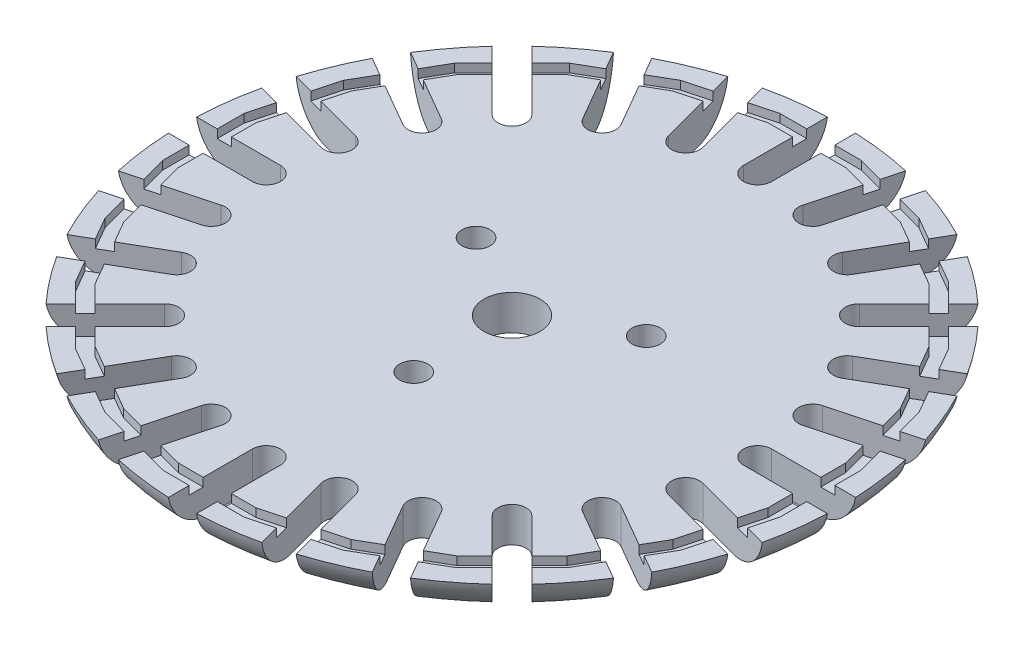
from build123d import *

# Parameters (mm, degrees)
ESBO_O1_R                = 23.5
RESSALTO_EXTRUS_O1_DEPTH = 2.5
FILETE1_R                = 3
CORTE_EXTRUS_O1_DEPTH    = 34.327916234
PADR_OCIRCULAR1_COUNT    = 24
CORTE_EXTRUS_O2_DEPTH    = 0.6
PADR_OCIRCULAR2_COUNT    = 24
ESBO_O5_R                = 2
CORTE_EXTRUS_O3_DEPTH    = 34.29789798
ESBO_O6_R                = 1
CORTE_EXTRUS_O4_DEPTH    = 34.29789798
ESBO_O7_R                = 2
CORTE_EXTRUS_O5_DEPTH    = 1
PADR_OCIRCULAR3_COUNT    = 3


with BuildPart() as part:
    # Esboço1 → Ressalto-extrusão1 (new body)
    with BuildSketch(Plane(origin=(0, 0, 0), x_dir=(1, 0, 0), z_dir=(0, 1, 0))):
        with Locations(Location((0, 0, 0), (0, 0, 270))):
            Circle(ESBO_O1_R)
    extrude(amount=RESSALTO_EXTRUS_O1_DEPTH)

    # Filete1
    # the kernel refuses this fillet: 3 mm, written as the material it takes off along each edge
    with BuildSketch(Plane(origin=(0, 0, 0), x_dir=(0, 0, 1), z_dir=(-1, 0, 0))) as filete1_piece_1:
        with BuildLine():
            CenterArc((20.541960108, 3), FILETE1_R, 270, 80.405931773)
            Line((20.541960108, 0), (20.541960108, -0.06))
            Line((20.541960108, -0.06), (23.5, -0.06))
            Line((23.5, -0.06), (23.56, 0))
            ThreePointArc((23.56, 0), (23.56, 1.25), (23.559160798, 2.49))
            Line((23.559160798, 2.49), (23.5, 2.5))
        make_face()
    revolve(axis=Axis((0, 0, 0), (0, 1, 0)), mode=Mode.SUBTRACT)

    # Esboço2 → Corte-extrusão1 (cut, through all)
    with BuildSketch(Plane(origin=(0, 2.5, 0), x_dir=(1, 0, 0), z_dir=(0, 1, 0))):
        with BuildLine():
            Line((1, 17.5), (1, 23.5))
            Line((1, 23.5), (-1, 23.5))
            Line((-1, 23.5), (-1, 17.5))
            ThreePointArc((-1, 17.5), (0, 16.5), (1, 17.5))
        make_face()
    corte_extrus_o1 = extrude(amount=-CORTE_EXTRUS_O1_DEPTH, mode=Mode.SUBTRACT)

    # PadrãoCircular1: Corte-extrusão1 ×24 about axis
    padr_ocircular1_axis = Axis((0, 0, 0), (0, 1, 0))
    for i in range(1, PADR_OCIRCULAR1_COUNT):
        add(corte_extrus_o1.rotate(padr_ocircular1_axis, i * 360 / PADR_OCIRCULAR1_COUNT), mode=Mode.SUBTRACT)

    # Esboço4 → Corte-extrusão2 (cut)
    with BuildSketch(Plane(origin=(0, 2.5, 0), x_dir=(1, 0, 0), z_dir=(0, 1, 0))):
        Polygon((-2.896354947, 22), (2.896354947, 22), (2.764702449, 21), (-2.764702449, 21), align=None)
    corte_extrus_o2 = extrude(amount=-CORTE_EXTRUS_O2_DEPTH, mode=Mode.SUBTRACT)

    # PadrãoCircular2: Corte-extrusão2 ×24 about axis
    padr_ocircular2_axis = Axis((0, 0, 0), (0, 1, 0))
    for i in range(1, PADR_OCIRCULAR2_COUNT):
        add(corte_extrus_o2.rotate(padr_ocircular2_axis, i * 360 / PADR_OCIRCULAR2_COUNT), mode=Mode.SUBTRACT)

    # Esboço5 → Corte-extrusão3 (cut, through all)
    with BuildSketch(Plane(origin=(0, 2.5, 0), x_dir=(1, 0, 0), z_dir=(0, 1, 0))):
        with Locations(Location((0, 0, 0), (0, 0, 270))):
            Circle(ESBO_O5_R)
    extrude(amount=-CORTE_EXTRUS_O3_DEPTH, mode=Mode.SUBTRACT)

    # Esboço6 → Corte-extrusão4 (cut, through all)
    with BuildSketch(Plane.XZ):
        with Locations(Location((0, 7, 0), (0, 0, 270))):
            Circle(ESBO_O6_R)
    corte_extrus_o4 = extrude(amount=-CORTE_EXTRUS_O4_DEPTH, mode=Mode.SUBTRACT)

    # Esboço7 → Corte-extrusão5 (cut)
    with BuildSketch(Plane.XZ):
        with Locations(Location((0, 7, 0), (0, 0, 270))):
            Circle(ESBO_O7_R)
    corte_extrus_o5 = extrude(amount=-CORTE_EXTRUS_O5_DEPTH, mode=Mode.SUBTRACT)

    # PadrãoCircular3: Corte-extrusão4, Corte-extrusão5 ×3 about axis
    padr_ocircular3_axis = Axis((0, 0, 0), (0, 1, 0))
    add([corte_extrus_o4.rotate(padr_ocircular3_axis, i * 360 / PADR_OCIRCULAR3_COUNT) for i in range(1, PADR_OCIRCULAR3_COUNT)], mode=Mode.SUBTRACT)
    add([corte_extrus_o5.rotate(padr_ocircular3_axis, i * 360 / PADR_OCIRCULAR3_COUNT) for i in range(1, PADR_OCIRCULAR3_COUNT)], mode=Mode.SUBTRACT)


solid = part.part
